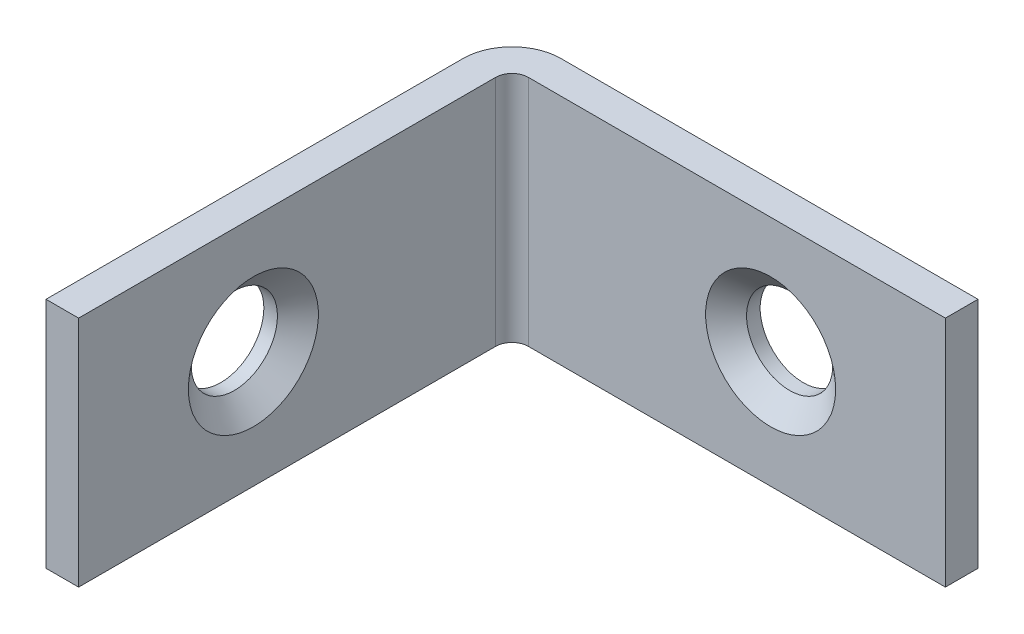
from build123d import *

# Parameters (mm, degrees)
EXTRUDE_THIN1_START = -6.35
EXTRUDE_THIN1_DEPTH = 12.7
SKETCH4_R           = 2.3495
EXTRUDE3_DEPTH      = 33.79453796
CIRPATTERN1_COUNT   = 2


# Read off the part's stored shape, not the designer's step: Extrude-Thin1
with BuildPart() as part:
    # Extrude-Thin1 outline → Extrude-Thin1 (new body)
    with BuildSketch(Plane(origin=(0, 0, 0), x_dir=(1, 0, 0), z_dir=(0, 1, 0)).offset(EXTRUDE_THIN1_START)):
        with BuildLine():
            Line((2.667, -1.778), (25.4, -1.778))
            Line((25.4, -1.778), (25.4, 0))
            Line((25.4, 0), (2.667, 0))
            ThreePointArc((2.667, 0), (0.781146215, -0.781146215), (0, -2.667))
            Line((0, -2.667), (0, -25.4))
            Line((0, -25.4), (1.778, -25.4))
            Line((1.778, -25.4), (1.778, -2.667))
            ThreePointArc((1.778, -2.667), (2.038382072, -2.038382072), (2.667, -1.778))
        make_face()
    extrude(amount=EXTRUDE_THIN1_DEPTH)

    # Sketch4 → Extrude3 (cut, through all)
    with BuildSketch(Plane(origin=(3.556, 0, 1.778), x_dir=(1, 0, 0), z_dir=(0, 0, 1))):
        with Locations((12.319, 0)):
            Circle(SKETCH4_R)
        with Locations((-13.081, 0)):
            Circle(SKETCH4_R)
        with Locations((-38.481, 0)):
            Circle(SKETCH4_R)
        with Locations((-63.881, 0)):
            Circle(SKETCH4_R)
    extrude3 = extrude(amount=-EXTRUDE3_DEPTH, mode=Mode.SUBTRACT)

    # Cut-Extrude1 cone 1 section (through the dimple's axis) → Cut-Extrude1 (revolve, cut)
    with BuildSketch(Plane(origin=(15.875, 0, 1.778), x_dir=(0, -1, 0), z_dir=(1, 0, 0))):
        Polygon((0, 0), (3.5433, 0), (0, 3.080143698), align=None)
    cut_extrude1 = revolve(axis=Axis((15.875, 0, 1.778), (0, 0, -1)), mode=Mode.SUBTRACT)

    # CirPattern1: Extrude3, Cut-Extrude1 ×2 about axis
    cirpattern1_axis = Axis((0, 0, 0), (0.7071067811865464, 0, 0.7071067811865487))
    add([extrude3.rotate(cirpattern1_axis, i * 360 / CIRPATTERN1_COUNT) for i in range(1, CIRPATTERN1_COUNT)], mode=Mode.SUBTRACT)
    add([cut_extrude1.rotate(cirpattern1_axis, i * 360 / CIRPATTERN1_COUNT) for i in range(1, CIRPATTERN1_COUNT)], mode=Mode.SUBTRACT)


solid = part.part
